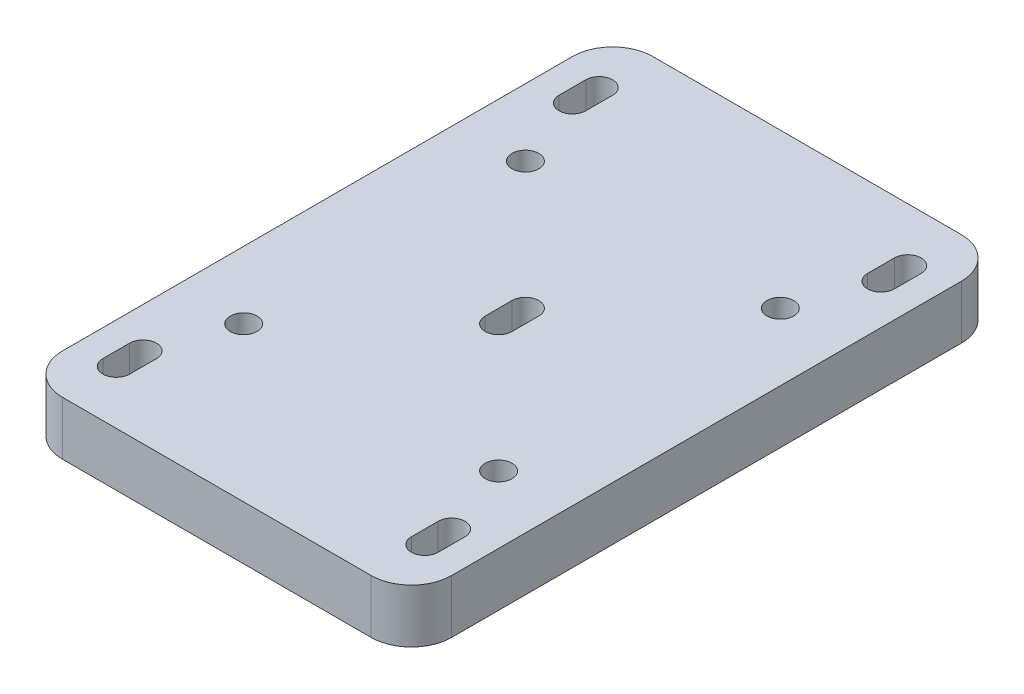
from build123d import *

# Parameters (mm, degrees)
SKETCH1_W                   = 92.075
SKETCH1_H                   = 139.7
BOSS_EXTRUDE1_DEPTH         = 12.7
F_1_4_0_25_DIAMETER_HOLE1_D = 6.35
CUT_EXTRUDE1_DEPTH          = 12.7
FILLET1_R                   = 9.525


with BuildPart() as part:
    # Sketch1 → Boss-Extrude1 (new body)
    with BuildSketch(Plane(origin=(0, 0, 0), x_dir=(1, 0, 0), z_dir=(0, 1, 0))):
        with Locations((46.0375, 69.85)):
            Rectangle(SKETCH1_W, SKETCH1_H)
    extrude(amount=BOSS_EXTRUDE1_DEPTH)

    # 1/4 (0.25) Diameter Hole1 (through all)
    with Locations(Plane(origin=(0, 12.7, 0), x_dir=(1, 0, 0), z_dir=(0, 1, 0))):
        with Locations((76.2, 36.5125), (46.0375, 69.85), (76.2, 103.1875), (15.875, 36.5125), (15.875, 103.1875)):
            Hole(F_1_4_0_25_DIAMETER_HOLE1_D / 2)

    # Sketch7 → Cut-Extrude1 (cut)
    with BuildSketch(Plane(origin=(0, 12.7, 0), x_dir=(1, 0, 0), z_dir=(0, 1, 0))):
        with BuildLine():
            Line((12.7, 127), (12.7, 120.65))
            ThreePointArc((12.7, 120.65), (9.525, 117.475), (6.35, 120.65))
            Line((6.35, 120.65), (6.35, 127))
            ThreePointArc((6.35, 127), (9.525, 130.175), (12.7, 127))
        make_face()
    cut_extrude1 = extrude(amount=-CUT_EXTRUDE1_DEPTH, mode=Mode.SUBTRACT)

    # Sketch-Pattern1: Cut-Extrude1 at 4 more places
    with Locations((36.5125, 0, 53.975), (73.025, 0, 0), (73.025, 0, 107.95), (0, 0, 107.95)):
        add(cut_extrude1, mode=Mode.SUBTRACT)

    # Fillet1
    fillet1_edges = [part.edges().sort_by_distance(p)[0] for p in [
        (92.075, 6.35, 0),
        (0, 6.35, 0),
        (0, 6.35, -139.7),
        (92.075, 6.35, -139.7),
    ]]
    fillet(fillet1_edges, radius=FILLET1_R)


solid = part.part
